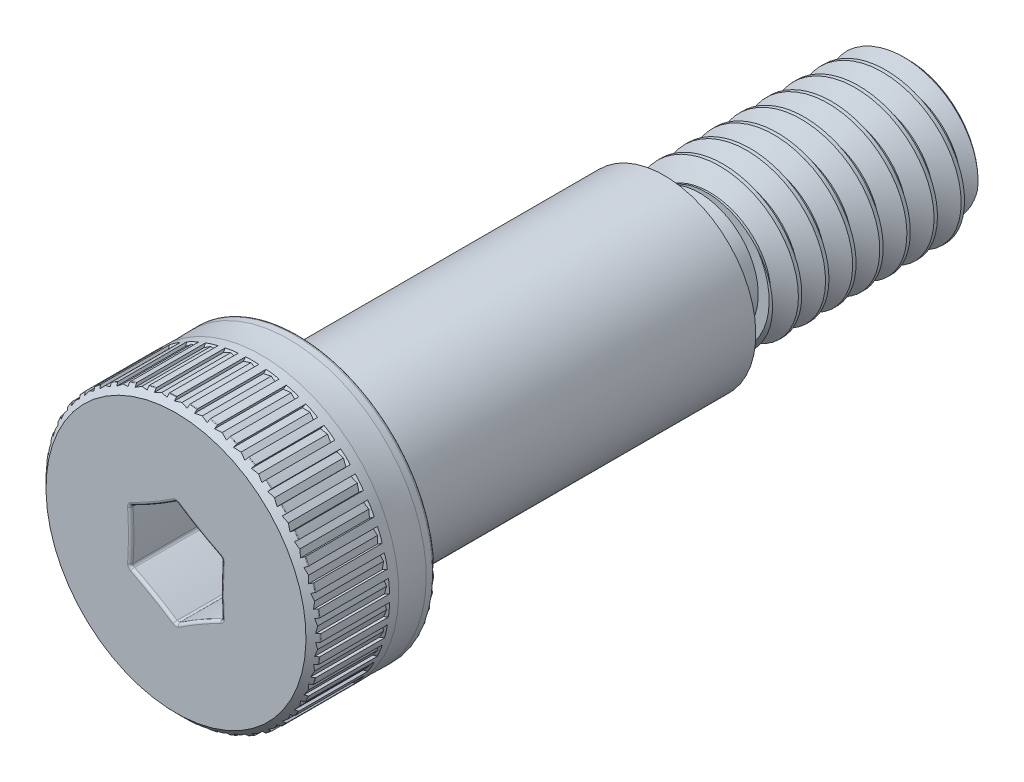
from build123d import *

# Parameters (mm, degrees)
SKETCH4_W             = 1.5875
SKETCH4_H             = 0.47625
SKETCH4_W_2           = 1.834444444
SKETCH4_H_2           = 0.916543552
CHAMFER1_SIZE         = 0.47625
FILLET1_R             = 0.28575
FILLET2_R             = 0.282222222
CHAMFER2_SIZE         = 0.352777778
CHAMFER3_SIZE         = 0.381
CUT_EXTRUDE1_DEPTH    = 3.9751
FILLET4_R             = 0.142875
DELETEFACE1_START     = -20.884444444
DELETEFACE1_OUTLINE_W = 10
DELETEFACE1_OUTLINE_H = 10
DELETEFACE1_OUTLINE_R = 3.058556448
DELETEFACE1_DEPTH     = 0.282222322
CUT_SWEEP1_PITCH      = 1.411111111
CUT_EXTRUDE2_REACH    = 41.417
CIRPATTERN1_COUNT     = 42
FILLET5_R             = 0.0508


# Read off the part's stored shape, not the designer's step: DeleteFace1, CirPattern2
with BuildPart() as part:
    # Sketch3 → Revolve1 (revolve)
    with BuildSketch(Plane(origin=(0, 0, 0), x_dir=(0, 0, -1), z_dir=(1, 0, 0)), mode=Mode.PRIVATE) as revolve1_sk:
        Polygon((-6.35, 7.14375), (0, 7.14375), (0, 4.7625), (19.05, 4.7625), (19.05, 3.9751), (31.75, 3.9751), (31.75, 0), (-6.35, 0), align=None)
    revolve(revolve1_sk.sketch.rotate(Axis((0, 0, 6.35), (0, 0, -1)), 180), axis=Axis((0, 0, 6.35), (0, 0, -1)))

    # Sketch4 → Cut-Revolve1 (revolve, cut)
    with BuildSketch(Plane(origin=(0, 0, 0), x_dir=(0, 0, -1), z_dir=(1, 0, 0)), mode=Mode.PRIVATE) as cut_revolve1_sk:
        with Locations((0.79375, 4.524375)):
            Rectangle(SKETCH4_W, SKETCH4_H)
        with Locations((19.967222222, 3.516828224)):
            Rectangle(SKETCH4_W_2, SKETCH4_H_2)
    revolve(cut_revolve1_sk.sketch.rotate(Axis((0, 0, 6.35), (0, 0, -1)), 180), axis=Axis((0, 0, 6.35), (0, 0, -1)), mode=Mode.SUBTRACT)

    # Chamfer1
    chamfer1_edges = [part.edges().sort_by_distance(p)[0] for p in [
        (0, 4.28625, -1.5875),
    ]]
    chamfer(chamfer1_edges, length=CHAMFER1_SIZE - 0.0001)  # a hair under: the kernel refuses the full size

    # Fillet1
    fillet1_edges = [part.edges().sort_by_distance(p)[0] for p in [
        (0, 4.28625, 0),
    ]]
    fillet(fillet1_edges, radius=FILLET1_R)

    # Fillet2
    fillet2_edges = [part.edges().sort_by_distance(p)[0] for p in [
        (0, 3.058556448, -19.05),
        (0, 3.058556448, -20.884444444),
    ]]
    fillet(fillet2_edges, radius=FILLET2_R)

    # Chamfer2
    chamfer2_edges = [part.edges().sort_by_distance(p)[0] for p in [
        (0, 3.9751, -20.884444444),
        (0, 3.9751, -31.75),
    ]]
    chamfer(chamfer2_edges, length=CHAMFER2_SIZE)

    # Chamfer3
    chamfer3_edges = [part.edges().sort_by_distance(p)[0] for p in [
        (0, 7.14375, 6.35),
    ]]
    chamfer(chamfer3_edges, length=CHAMFER3_SIZE)

    # Sketch5 → Cut-Extrude1 (cut)
    with BuildSketch(Plane.XY.offset(6.35)):
        with BuildLine():
            ThreePointArc((2.38125, 1.374815329), (1.1668125, 2.020978533), (0, 2.749630657))
            ThreePointArc((0, 2.749630657), (-1.1668125, 2.020978533), (-2.38125, 1.374815329))
            ThreePointArc((-2.38125, 1.374815329), (-2.333625, 0), (-2.38125, -1.374815329))
            ThreePointArc((-2.38125, -1.374815329), (-1.1668125, -2.020978533), (0, -2.749630657))
            ThreePointArc((0, -2.749630657), (1.1668125, -2.020978533), (2.38125, -1.374815329))
            ThreePointArc((2.38125, -1.374815329), (2.333625, 0), (2.38125, 1.374815329))
        make_face()
    extrude(amount=-CUT_EXTRUDE1_DEPTH, mode=Mode.SUBTRACT)

    # Fillet4
    fillet4_edges = [part.edges().sort_by_distance(p)[0] for p in [
        (2.333625, 0, 2.3749),
        (2.38125, 1.374815329, 4.36245),
        (1.1668125, -2.020978533, 2.3749),
        (2.38125, -1.374815329, 4.36245),
        (-1.1668125, -2.020978533, 2.3749),
        (0, -2.749630657, 4.36245),
        (-2.333625, 0, 2.3749),
        (-2.38125, -1.374815329, 4.36245),
        (-1.1668125, 2.020978533, 2.3749),
        (-2.38125, 1.374815329, 4.36245),
        (1.1668125, 2.020978533, 2.3749),
        (0, 2.749630657, 4.36245),
        (2.333625, 0, 6.35),
        (1.1668125, 2.020978533, 6.35),
        (-1.1668125, 2.020978533, 6.35),
        (-2.333625, 0, 6.35),
        (-1.1668125, -2.020978533, 6.35),
        (1.1668125, -2.020978533, 6.35),
        (0, 7.14375, 0),
    ]]
    fillet(fillet4_edges, radius=FILLET4_R)

    # DeleteFace1 outline → DeleteFace1 (cut)
    with BuildSketch(Plane.XY.offset(DELETEFACE1_START)):
        Rectangle(DELETEFACE1_OUTLINE_W, DELETEFACE1_OUTLINE_H)
        Circle(DELETEFACE1_OUTLINE_R, mode=Mode.SUBTRACT)
    extrude(amount=DELETEFACE1_DEPTH, mode=Mode.SUBTRACT)

    # Cut-Sweep1: the profile of Sketch7 profile screwed along a right-hand helix of 8.48 turns, 8 arcs to a turn; built about Z, then put on its axis
    cut_sweep1_z = Axis((0, 0, 0), (0, 0, 1))
    cut_sweep1_corners = [(4.051478629, 0, 0.044097222), (4.051478629, 0, -1.278819444), (3.058256448, 0, -0.70538235), (3.058256448, 0, -0.529339872)]
    with BuildLine(mode=Mode.PRIVATE) as cut_sweep1_profile:
        Line(cut_sweep1_corners[0], cut_sweep1_corners[1])
        Line(cut_sweep1_corners[1], cut_sweep1_corners[2])
        Line(cut_sweep1_corners[2], cut_sweep1_corners[3])
        Line(cut_sweep1_corners[3], cut_sweep1_corners[0])
    cut_sweep1_cap = Face(cut_sweep1_profile.wire())
    cut_sweep1_turn_angles = [0, 22.5, 45, 67.5, 90, 112.5, 135, 157.5, 180, 202.5, 225, 247.5, 270, 292.5, 315, 337.5, 360]
    cut_sweep1_turn_weights = [1, 0.9238795325112867, 1, 0.9238795325112867, 1, 0.9238795325112867, 1, 0.9238795325112867, 1, 0.9238795325112867, 1, 0.9238795325112867, 1, 0.9238795325112867, 1, 0.9238795325112867, 1]
    cut_sweep1_turn_rails = [Edge.make_bspline([Vector(p[0], p[1], 0).rotate(cut_sweep1_z, cut_sweep1_turn_angles[k]) / cut_sweep1_turn_weights[k] + Vector(0, 0, p[2] + CUT_SWEEP1_PITCH * cut_sweep1_turn_angles[k] / 360) for k in range(17)], [0, 0, 0, 1, 1, 2, 2, 3, 3, 4, 4, 5, 5, 6, 6, 7, 7, 8, 8, 8], 2, cut_sweep1_turn_weights) for p in cut_sweep1_corners]
    cut_sweep1_turn_sides = [Face.make_surface_from_curves(cut_sweep1_turn_rails[p[0]], cut_sweep1_turn_rails[p[1]]) for p in [(0, 1), (1, 2), (2, 3), (3, 0)]]
    cut_sweep1_last_angles = [2880, 2902.5, 2925, 2947.5, 2970, 2992.5, 3015, 3033.9, 3052.8]
    cut_sweep1_last_weights = [1, 0.9238795325112867, 1, 0.9238795325112867, 1, 0.9238795325112867, 1, 0.9460853588276014, 1]
    cut_sweep1_last_rails = [Edge.make_bspline([Vector(p[0], p[1], 0).rotate(cut_sweep1_z, cut_sweep1_last_angles[k]) / cut_sweep1_last_weights[k] + Vector(0, 0, p[2] + CUT_SWEEP1_PITCH * cut_sweep1_last_angles[k] / 360) for k in range(9)], [0, 0, 0, 1, 1, 2, 2, 3, 3, 4, 4, 4], 2, cut_sweep1_last_weights) for p in cut_sweep1_corners]
    cut_sweep1_last_sides = [Face.make_surface_from_curves(cut_sweep1_last_rails[p[0]], cut_sweep1_last_rails[p[1]]) for p in [(0, 1), (1, 2), (2, 3), (3, 0)]]
    cut_sweep1 = Plane(origin=(0, 0, -31.75), x_dir=(0, 1, 0), z_dir=(0, 0, 1)) * Solid(Shell([*[p.moved(Location((0, 0, CUT_SWEEP1_PITCH * i))) for i in range(8) for p in cut_sweep1_turn_sides], *cut_sweep1_last_sides, cut_sweep1_cap, cut_sweep1_cap.rotate(cut_sweep1_z, 3052.8).moved(Location((0, 0, CUT_SWEEP1_PITCH * 3052.8 / 360)))]))
    add(cut_sweep1, mode=Mode.SUBTRACT)

    # Cut-Extrude2: up to this plane
    cut_extrude2_end = Plane(origin=(0, 8.546915019, 0.978084981), z_dir=(0, 0.707106781186546, 0.7071067811865491))
    # Sketch8 → Cut-Extrude2 (cut, up to the surface)
    with BuildSketch(Plane.XY.offset(6.35), mode=Mode.PRIVATE) as cut_extrude2_sk1:
        Polygon((-0.3429, 7.14375), (0.3429, 7.14375), (0.328483903, 7.00659), (0, 7.07517), (-0.328483903, 7.00659), align=None)
    cut_extrude2_tool1 = split(extrude(cut_extrude2_sk1.sketch, amount=-CUT_EXTRUDE2_REACH, mode=Mode.PRIVATE), bisect_by=cut_extrude2_end, keep=Keep.BOTH, mode=Mode.PRIVATE)
    cut_extrude2 = cut_extrude2_tool1.solids().sort_by_distance((0, 7.090627, 6.35))[0]
    add(cut_extrude2, mode=Mode.SUBTRACT)

    # CirPattern1: Cut-Extrude2 ×42 about axis
    cirpattern1_axis = Axis((0, 0, 0), (0, 0, 1))
    for i in range(1, CIRPATTERN1_COUNT):
        add(cut_extrude2.rotate(cirpattern1_axis, i * 360 / CIRPATTERN1_COUNT), mode=Mode.SUBTRACT)

    # Fillet5
    fillet5_edges = [part.edges().sort_by_distance(p)[0] for p in [
        (0.533853106, 7.123774626, 5.969),
    ]]
    fillet(fillet5_edges, radius=FILLET5_R)

    # CirPattern2 outline → CirPattern2 (revolve, cut)
    with BuildSketch(Plane.XZ):
        with BuildLine():
            ThreePointArc((7.128871024, 5.983878976), (7.13988308, 5.96739827), (7.14375, 5.947957951))
            Line((7.14375, 5.947957951), (7.14375, 5.983878976))
            Line((7.14375, 5.983878976), (7.128871024, 5.983878976))
        make_face()
    revolve(axis=Axis((0, 0, 0), (0, 0, 1)), mode=Mode.SUBTRACT)

    # Sketch11 → Cut-Revolve6 (revolve, cut)
    with BuildSketch(Plane(origin=(0, 0, 0), x_dir=(0, 0, -1), z_dir=(1, 0, 0)), mode=Mode.PRIVATE) as cut_revolve6_sk:
        with BuildLine():
            Line((-1.905, 7.14375), (-0.47625, 7.14375))
            ThreePointArc((-0.47625, 7.14375), (-1.190625, 7.12597), (-1.905, 7.14375))
        make_face()
    revolve(cut_revolve6_sk.sketch.rotate(Axis((0, 0, 6.35), (0, 0, -1)), 180), axis=Axis((0, 0, 6.35), (0, 0, -1)), mode=Mode.SUBTRACT)


solid = part.part
